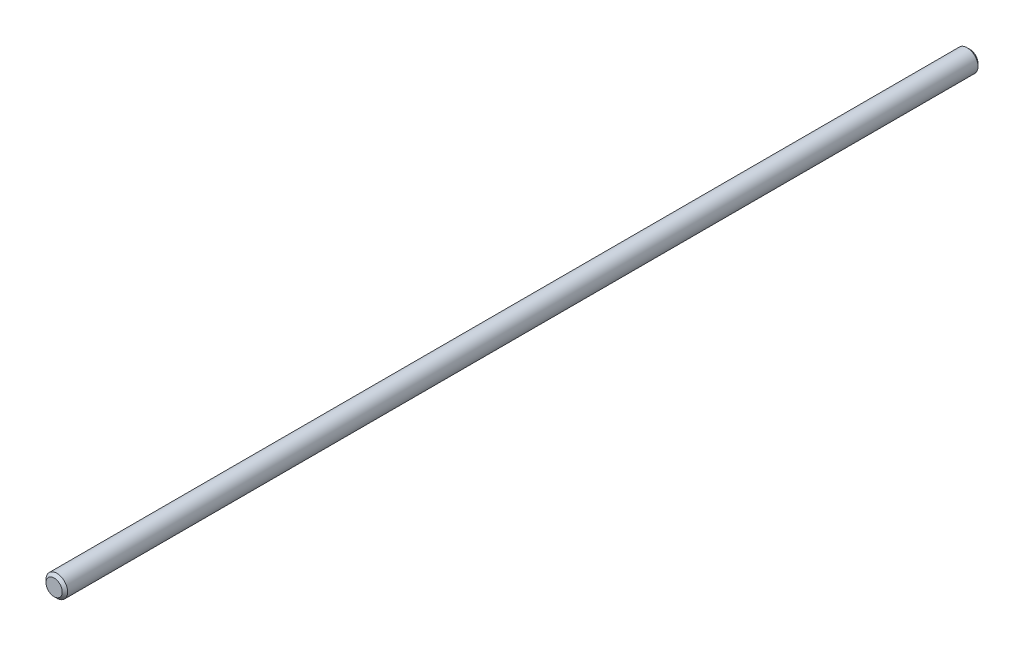
from build123d import *

# Parameters (mm, degrees)
SCHIZZO1_R                   = 4
ESTRUSIONE_ESTRUSIONE1_DEPTH = 338
SMUSSO1_SIZE                 = 1


with BuildPart() as part:
    # Schizzo1 → Estrusione-Estrusione1 (new body)
    with BuildSketch(Plane.XY):
        Circle(SCHIZZO1_R)
    extrude(amount=ESTRUSIONE_ESTRUSIONE1_DEPTH)

    # Smusso1
    smusso1_edges = [part.edges().sort_by_distance(p)[0] for p in [
        (-4, 0, 338),
        (-4, 0, 0),
    ]]
    chamfer(smusso1_edges, length=SMUSSO1_SIZE)


solid = part.part
